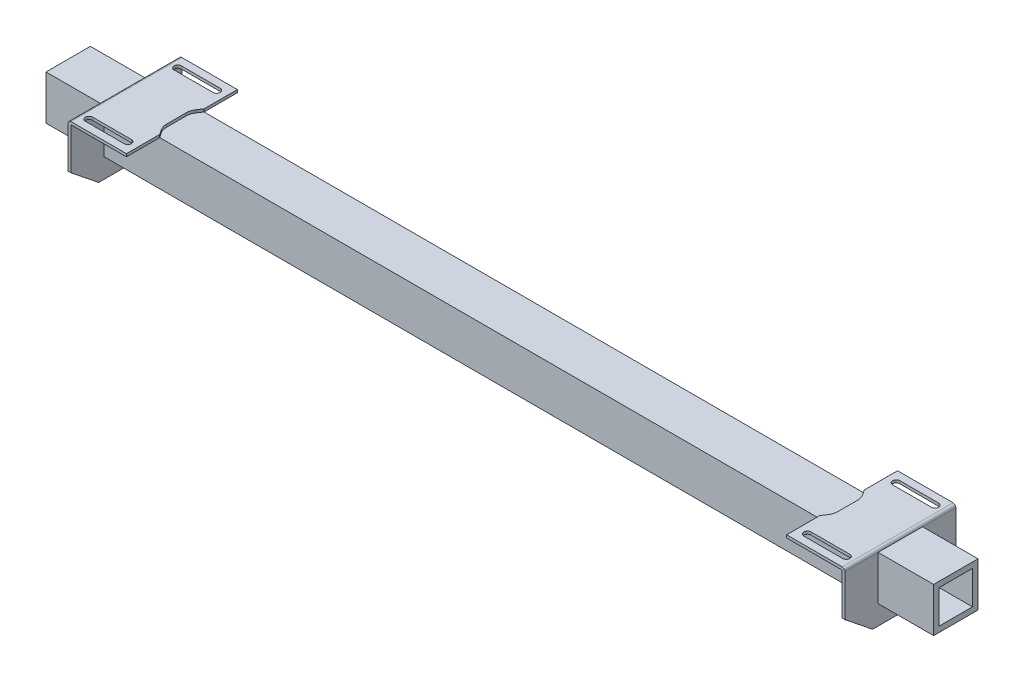
from build123d import *

# Parameters (mm, degrees)
SKETCH3_W                       = 80
SKETCH3_H                       = 80
SKETCH3_W_2                     = 60
SKETCH3_H_2                     = 60
BOSS_EXTRUDE2_DEPTH             = 1600
SKETCH7_W                       = 60
SKETCH7_H                       = 60
BOSS_EXTRUDE3_DEPTH             = 5
BOSS_EXTRUDE4_REACH             = 1610.361
SKETCH8_W                       = 105
SKETCH8_H                       = 5
BOSS_EXTRUDE4_DIRECTION_2_REACH = 1610.361
CUT_EXTRUDE1_DEPTH              = 5
CUT_EXTRUDE2_REACH              = 1612.59
FILLET1_R                       = 5
FILLET1_OF_MIRROR1_R            = 5
FILLET1_OF_MIRROR2_R            = 5


with BuildPart() as part:
    # Sketch3 → Boss-Extrude2 (new body)
    with BuildSketch(Plane(origin=(0, 0, 0), x_dir=(0, 0, -1), z_dir=(1, 0, 0))):
        with Locations((40, 40)):
            Rectangle(SKETCH3_W, SKETCH3_H)
        with Locations((40, 40)):
            Rectangle(SKETCH3_W_2, SKETCH3_H_2, mode=Mode.SUBTRACT)
    extrude(amount=BOSS_EXTRUDE2_DEPTH)

    # Sketch7 → Boss-Extrude3 (add)
    with BuildSketch(Plane(origin=(1495, 0, 0), x_dir=(0, 0, -1), z_dir=(1, 0, 0))):
        Polygon((-60, 85), (140, 85), (140, 5), (90, -35), (-10, -35), (-60, 5), align=None)
        with Locations((40, 40)):
            Rectangle(SKETCH7_W, SKETCH7_H, mode=Mode.SUBTRACT)
    boss_extrude3 = extrude(amount=BOSS_EXTRUDE3_DEPTH)

    # Boss-Extrude4: up to this face of the body (flat: up to its plane)
    boss_extrude4_end = Plane(part.part.faces().sort_by_distance((1497.5, 45, -140))[0])
    # Sketch8 → Boss-Extrude4 (add, up to the picked face)
    with BuildSketch(Plane(origin=(0, 0, -80), x_dir=(-1, 0, 0), z_dir=(0, 0, -1)), mode=Mode.PRIVATE) as boss_extrude4_sk1:
        with Locations((-1447.5, 82.5)):
            Rectangle(SKETCH8_W, SKETCH8_H)
    boss_extrude4_tool1 = split(extrude(boss_extrude4_sk1.sketch, amount=BOSS_EXTRUDE4_REACH, mode=Mode.PRIVATE), bisect_by=boss_extrude4_end, keep=Keep.BOTH, mode=Mode.PRIVATE)
    boss_extrude4 = boss_extrude4_tool1.solids().sort_by(Axis((1447.5, 82.5, -80), (0, 0, -1)))[0]
    add(boss_extrude4)

    # Boss-Extrude4 direction 2: up to this face of the body (flat: up to its plane)
    boss_extrude4_direction_2_end = Plane(part.part.faces().sort_by_distance((1497.5, 45, 60))[0])
    # Sketch8 → Boss-Extrude4 direction 2 (add, up to the picked face)
    with BuildSketch(Plane(origin=(0, 0, -80), x_dir=(-1, 0, 0), z_dir=(0, 0, -1)), mode=Mode.PRIVATE) as boss_extrude4_direction_2_sk1:
        with Locations((-1447.5, 82.5)):
            Rectangle(SKETCH8_W, SKETCH8_H)
    boss_extrude4_direction_2_tool1 = split(extrude(boss_extrude4_direction_2_sk1.sketch, amount=-BOSS_EXTRUDE4_DIRECTION_2_REACH, mode=Mode.PRIVATE), bisect_by=boss_extrude4_direction_2_end, keep=Keep.BOTH, mode=Mode.PRIVATE)
    boss_extrude4_direction_2 = boss_extrude4_direction_2_tool1.solids().sort_by(Axis((1447.5, 82.5, -80), (0, 0, 1)))[0]
    add(boss_extrude4_direction_2)

    # Sketch9 → Cut-Extrude1 (cut)
    with BuildSketch(Plane(origin=(0, 85, 0), x_dir=(1, 0, 0), z_dir=(0, 1, 0))):
        with BuildLine():
            Line((1395, 80), (1400.801257358, 71.298113962))
            ThreePointArc((1400.801257358, 71.298113962), (1403.927300662, 64.675212774), (1405, 57.430609057))
            Line((1405, 57.430609057), (1405, 22.569390943))
            ThreePointArc((1405, 22.569390943), (1403.927300662, 15.324787226), (1400.801257358, 8.701886038))
            Line((1400.801257358, 8.701886038), (1395, 0))
            Line((1395, 0), (1395, 80))
        make_face()
    cut_extrude1 = extrude(amount=-CUT_EXTRUDE1_DEPTH, mode=Mode.SUBTRACT)

    # Sketch10 → Cut-Extrude2 (cut, up to next)
    with BuildSketch(Plane(origin=(0, 85, 0), x_dir=(1, 0, 0), z_dir=(0, 1, 0)), mode=Mode.PRIVATE) as cut_extrude2_sk1:
        with BuildLine():
            Line((1412.5, 126.5), (1482.5, 126.5))
            ThreePointArc((1482.5, 126.5), (1489, 120), (1482.5, 113.5))
            Line((1482.5, 113.5), (1412.5, 113.5))
            ThreePointArc((1412.5, 113.5), (1406, 120), (1412.5, 126.5))
        make_face()
    cut_extrude2_tool1 = extrude(cut_extrude2_sk1.sketch, amount=-CUT_EXTRUDE2_REACH, mode=Mode.PRIVATE) & part.part
    # Sketch10 → Cut-Extrude2 (cut, up to next)
    with BuildSketch(Plane(origin=(0, 85, 0), x_dir=(1, 0, 0), z_dir=(0, 1, 0)), mode=Mode.PRIVATE) as cut_extrude2_sk2:
        with BuildLine():
            Line((1412.5, -33.5), (1482.5, -33.5))
            ThreePointArc((1482.5, -33.5), (1489, -40), (1482.5, -46.5))
            Line((1482.5, -46.5), (1412.5, -46.5))
            ThreePointArc((1412.5, -46.5), (1406, -40), (1412.5, -33.5))
        make_face()
    cut_extrude2_tool2 = extrude(cut_extrude2_sk2.sketch, amount=-CUT_EXTRUDE2_REACH, mode=Mode.PRIVATE) & part.part
    cut_extrude2_1 = cut_extrude2_tool1.solids().sort_by_distance((1447.5, 85, -120))[0]
    add(cut_extrude2_1, mode=Mode.SUBTRACT)
    cut_extrude2_2 = cut_extrude2_tool2.solids().sort_by_distance((1447.5, 85, 40))[0]
    add(cut_extrude2_2, mode=Mode.SUBTRACT)
    cut_extrude2 = cut_extrude2_1 + cut_extrude2_2  # Cut-Extrude2 as one shape, for the pattern or mirror that repeats it

    # Fillet1
    fillet1_edges = [part.edges().sort_by_distance(p)[0] for p in [
        (1500, 85, -40),
    ]]
    fillet(fillet1_edges, radius=FILLET1_R - 0.0001)  # a hair under: the kernel refuses the full size

    # Mirror1: Boss-Extrude3 across plane
    add(boss_extrude3.mirror(Plane(origin=(800, 0, 0), x_dir=(0, 0, 1), z_dir=(1, 0, 0))))

    # Fillet1 of Mirror1
    fillet1_of_mirror1_edges = [part.edges().sort_by_distance(p)[0] for p in [
        (100, 85, -40),
    ]]
    fillet(fillet1_of_mirror1_edges, radius=FILLET1_OF_MIRROR1_R - 0.0001)  # a hair under: the kernel refuses the full size

    # Mirror2: Boss-Extrude3, Boss-Extrude4, Boss-Extrude4 direction 2, Cut-Extrude1, Cut-Extrude2 across plane
    add(boss_extrude3.mirror(Plane(origin=(800, 0, 0), x_dir=(0, 0, 1), z_dir=(1, 0, 0))))
    add(boss_extrude4.mirror(Plane(origin=(800, 0, 0), x_dir=(0, 0, 1), z_dir=(1, 0, 0))))
    add(boss_extrude4_direction_2.mirror(Plane(origin=(800, 0, 0), x_dir=(0, 0, 1), z_dir=(1, 0, 0))))
    add(cut_extrude1.mirror(Plane(origin=(800, 0, 0), x_dir=(0, 0, 1), z_dir=(1, 0, 0))), mode=Mode.SUBTRACT)
    add(cut_extrude2.mirror(Plane(origin=(800, 0, 0), x_dir=(0, 0, 1), z_dir=(1, 0, 0))), mode=Mode.SUBTRACT)

    # Fillet1 of Mirror2
    fillet1_of_mirror2_edges = [part.edges().sort_by_distance(p)[0] for p in [
        (100, 85, -40),
    ]]
    fillet(fillet1_of_mirror2_edges, radius=FILLET1_OF_MIRROR2_R - 0.0001)  # a hair under: the kernel refuses the full size


solid = part.part
